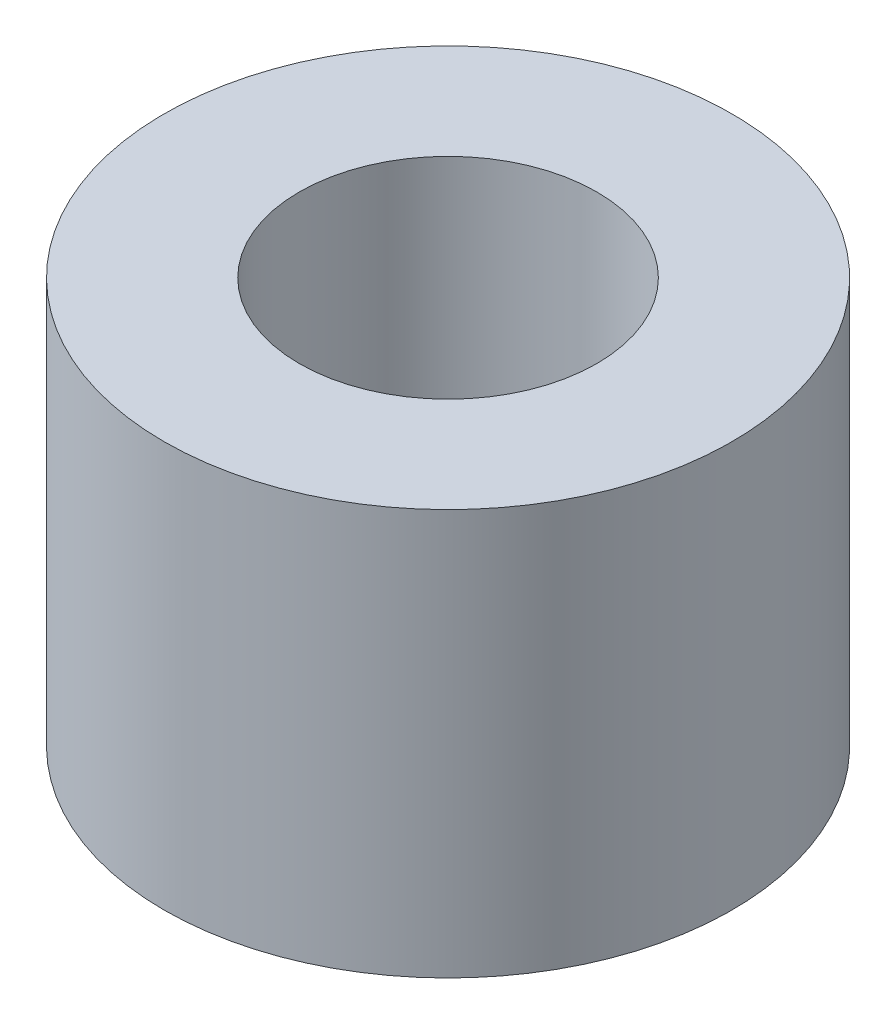
from build123d import *

# Parameters (mm, degrees)
SKETCH1_R           = 10.5
SKETCH1_R_2         = 5.5
BOSS_EXTRUDE1_DEPTH = 15


with BuildPart() as part:
    # Sketch1 → Boss-Extrude1 (new body)
    with BuildSketch(Plane(origin=(0, 0, 0), x_dir=(1, 0, 0), z_dir=(0, 1, 0))):
        Circle(SKETCH1_R)
        Circle(SKETCH1_R_2, mode=Mode.SUBTRACT)
    extrude(amount=BOSS_EXTRUDE1_DEPTH)


solid = part.part
